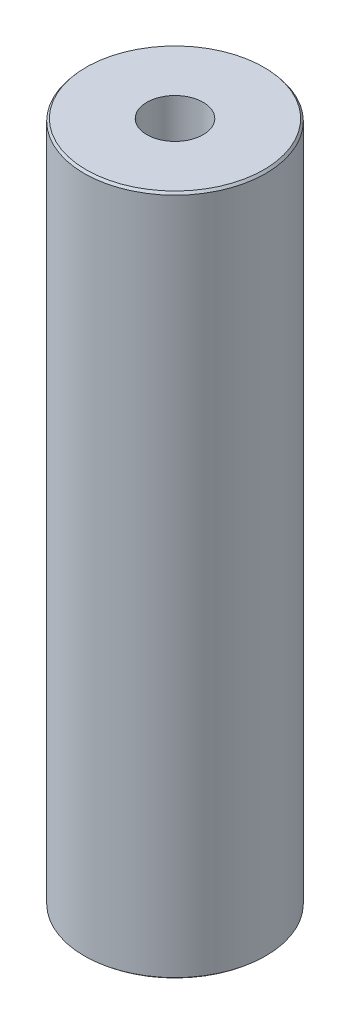
from build123d import *
from OCP.BRepFilletAPI import BRepFilletAPI_MakeChamfer

# Parameters (mm, degrees)
SKETCH1_R           = 55
BOSS_EXTRUDE1_DEPTH = 413.183128741
SKETCH2_R           = 17.064022717
CUT_EXTRUDE1_DEPTH  = 421.4405997
CHAMFER1_SIZE       = 1.377402881
CHAMFER1_SIZE2      = 1.147405139


with BuildPart() as part:
    # Sketch1 → Boss-Extrude1 (new body)
    with BuildSketch(Plane(origin=(0, 0, 0), x_dir=(1, 0, 0), z_dir=(0, 1, 0))):
        Circle(SKETCH1_R)
    extrude(amount=BOSS_EXTRUDE1_DEPTH)

    # Sketch2 → Cut-Extrude1 (cut, through all)
    with BuildSketch(Plane(origin=(0, 0, 0), x_dir=(1, 0, 0), z_dir=(0, 1, 0))):
        Circle(SKETCH2_R)
    extrude(amount=CUT_EXTRUDE1_DEPTH, mode=Mode.SUBTRACT)

    # Chamfer1: one chamfer whose edges measure the first distance from different faces: ONE call of the kernel's chamfer builder (chamfer() names one face for all edges)
    chamfer1_edges_1 = [part.edges().sort_by_distance(p)[0] for p in [
        (-55, 413.183128741, 0),
    ]]
    chamfer1_side_1 = [part.faces().sort_by_distance(p)[0] for p in [
        (-55, 206.59156437, 0),
    ]]
    chamfer1_edges_2 = [part.edges().sort_by_distance(p)[0] for p in [
        (-55, 0, 0),
    ]]
    chamfer1_side_2 = [part.faces().sort_by_distance(p)[0] for p in [
        (-53.444365081, 0, 0),
    ]]
    chamfer1 = BRepFilletAPI_MakeChamfer(part.part.solid().wrapped)
    for e in chamfer1_edges_1:
        chamfer1.Add(CHAMFER1_SIZE, CHAMFER1_SIZE2, e.wrapped, chamfer1_side_1[0].wrapped)  # the first distance lies on this face
    for e in chamfer1_edges_2:
        chamfer1.Add(CHAMFER1_SIZE, CHAMFER1_SIZE2, e.wrapped, chamfer1_side_2[0].wrapped)  # the first distance lies on this face
    add(Compound.cast(chamfer1.Shape()), mode=Mode.REPLACE)


solid = part.part
